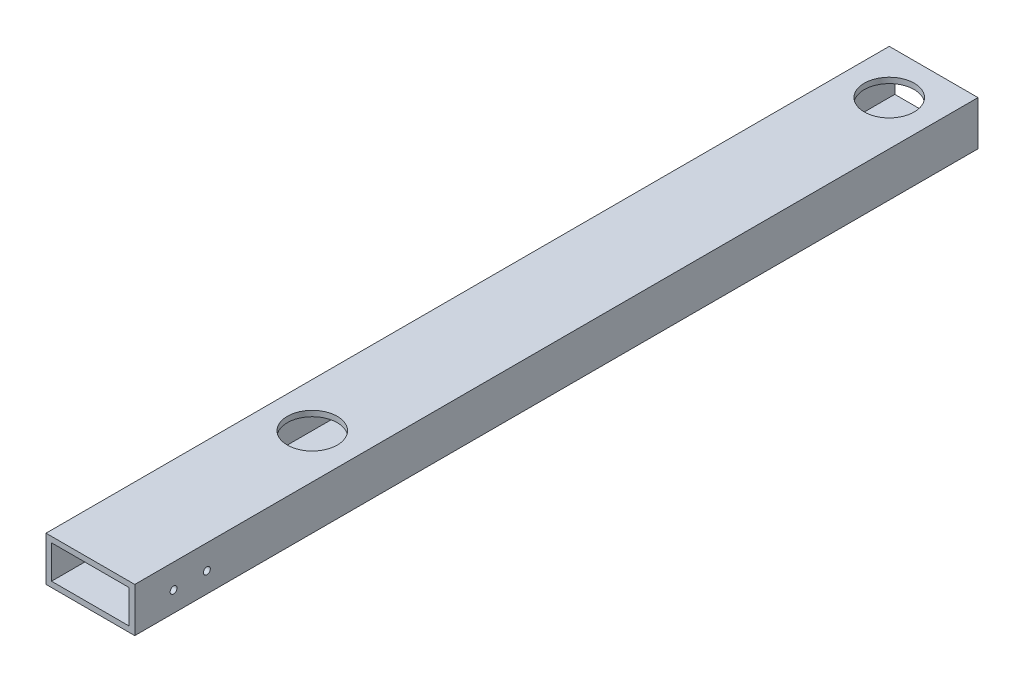
from build123d import *

# Parameters (mm, degrees)
SKETCH1_W           = 50.8
SKETCH1_H           = 25.4
BOSS_EXTRUDE1_DEPTH = 241.3
SKETCH2_W           = 44.45
SKETCH2_H           = 19.05
CUT_EXTRUDE1_DEPTH  = 484.434804291
SKETCH5_R           = 14.2875
CUT_EXTRUDE2_DEPTH  = 508
SKETCH7_R           = 14.2875
CUT_EXTRUDE4_DEPTH  = 244.959033446
SKETCH8_R           = 1.9812
CUT_EXTRUDE5_DEPTH  = 247.916220609


with BuildPart() as part:
    # Sketch1 → Boss-Extrude1 (new, symmetric)
    with BuildSketch(Plane.XY):
        Rectangle(SKETCH1_W, SKETCH1_H)
    extrude(amount=BOSS_EXTRUDE1_DEPTH, both=True)

    # Sketch2 → Cut-Extrude1 (cut, through all)
    with BuildSketch(Plane.XY.offset(241.3)):
        Rectangle(SKETCH2_W, SKETCH2_H)
    extrude(amount=-CUT_EXTRUDE1_DEPTH, mode=Mode.SUBTRACT)

    # Sketch5 → Cut-Extrude2 (cut)
    with BuildSketch(Plane(origin=(0, 12.7, 0), x_dir=(1, 0, 0), z_dir=(0, 1, 0))):
        with Locations((0, 215.9)):
            Circle(SKETCH5_R)
    extrude(amount=-CUT_EXTRUDE2_DEPTH, mode=Mode.SUBTRACT)

    # Sketch7 → Cut-Extrude4 (cut, through all)
    with BuildSketch(Plane(origin=(0, 12.7, 0), x_dir=(1, 0, 0), z_dir=(0, 1, 0))):
        with Locations((0, -114.3)):
            Circle(SKETCH7_R)
    extrude(amount=-CUT_EXTRUDE4_DEPTH, mode=Mode.SUBTRACT)

    # Sketch8 → Cut-Extrude5 (cut, through all)
    with BuildSketch(Plane(origin=(25.4, 0, 0), x_dir=(0, 0, -1), z_dir=(1, 0, 0))):
        with Locations((-219.075, -1.143)):
            Circle(SKETCH8_R)
        with Locations((-200.025, -1.143)):
            Circle(SKETCH8_R)
    extrude(amount=-CUT_EXTRUDE5_DEPTH, mode=Mode.SUBTRACT)


solid = part.part
